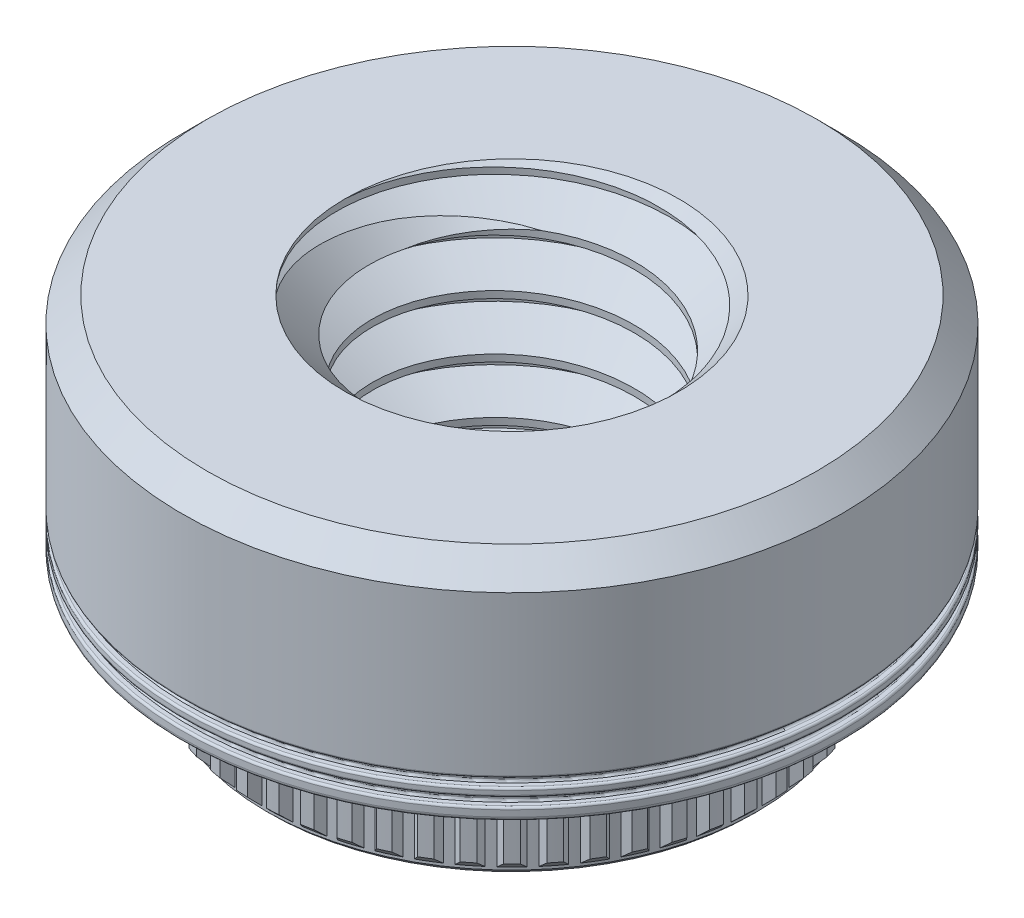
from build123d import *

# Parameters (mm, degrees)
SWEEP1_PITCH       = 0.79375
CUT_EXTRUDE1_REACH = 10.242
CIRPATTERN1_COUNT  = 52


with BuildPart() as part:
    # Sketch3 → Revolve1 (revolve)
    with BuildSketch(Plane.XY, mode=Mode.PRIVATE) as revolve1_sk:
        with BuildLine():
            Line((-2.413, 2.3749), (-2.413, -2.3749))
            Line((-2.413, -2.3749), (-3.48535625, -2.3749))
            Line((-3.48535625, -2.3749), (-3.54965, -2.31060625))
            Line((-3.54965, -2.31060625), (-3.54965, -2.27203))
            Line((-3.54965, -2.27203), (-3.683, -2.13868))
            Line((-3.683, -2.13868), (-3.683, -1.27))
            Line((-3.683, -1.27), (-3.54965, -1.13665))
            Line((-3.54965, -1.13665), (-3.5258375, -1.13665))
            ThreePointArc((-3.5258375, -1.13665), (-3.475323559, -1.115726441), (-3.4544, -1.0652125))
            Line((-3.4544, -1.0652125), (-3.4544, -0.9223375))
            ThreePointArc((-3.4544, -0.9223375), (-3.475323559, -0.871823559), (-3.5258375, -0.8509))
            Line((-3.5258375, -0.8509), (-4.70201625, -0.8509))
            ThreePointArc((-4.70201625, -0.8509), (-4.74478472, -0.83318472), (-4.7625, -0.79041625))
            Line((-4.7625, -0.79041625), (-4.7625, -0.699690625))
            ThreePointArc((-4.7625, -0.699690625), (-4.75364236, -0.67830639), (-4.732258125, -0.66944875))
            Line((-4.732258125, -0.66944875), (-4.671774375, -0.66944875))
            ThreePointArc((-4.671774375, -0.66944875), (-4.65039014, -0.66059111), (-4.6415325, -0.639206875))
            Line((-4.6415325, -0.639206875), (-4.6415325, -0.578723125))
            ThreePointArc((-4.6415325, -0.578723125), (-4.65039014, -0.55733889), (-4.671774375, -0.54848125))
            Line((-4.671774375, -0.54848125), (-4.732258125, -0.54848125))
            ThreePointArc((-4.732258125, -0.54848125), (-4.75364236, -0.53962361), (-4.7625, -0.518239375))
            Line((-4.7625, -0.518239375), (-4.7625, -0.457755625))
            ThreePointArc((-4.7625, -0.457755625), (-4.75364236, -0.43637139), (-4.732258125, -0.42751375))
            Line((-4.732258125, -0.42751375), (-4.671774375, -0.42751375))
            ThreePointArc((-4.671774375, -0.42751375), (-4.65039014, -0.41865611), (-4.6415325, -0.397271875))
            Line((-4.6415325, -0.397271875), (-4.6415325, -0.336788125))
            ThreePointArc((-4.6415325, -0.336788125), (-4.65039014, -0.31540389), (-4.671774375, -0.30654625))
            Line((-4.671774375, -0.30654625), (-4.732258125, -0.30654625))
            ThreePointArc((-4.732258125, -0.30654625), (-4.75364236, -0.29768861), (-4.7625, -0.276304375))
            Line((-4.7625, -0.276304375), (-4.7625, 2.0177125))
            Line((-4.7625, 2.0177125), (-4.4053125, 2.3749))
            Line((-4.4053125, 2.3749), (-2.413, 2.3749))
        make_face()
    revolve(revolve1_sk.sketch.rotate(Axis((0, -2.3749, 0), (0, 1, 0)), 180), axis=Axis((0, -2.3749, 0), (0, 1, 0)))

    # Sweep1: the profile of Sketch5 screwed along a right-hand helix of 6.984 turns, 8 arcs to a turn; built about Z, then put on its axis
    sweep1_z = Axis((0, 0, 0), (0, 0, 1))
    sweep1_corners = [(2.455962979, 0, 0.024804687), (2.455962979, 0, -0.719335938), (1.897444252, 0, -0.396875), (1.897444252, 0, -0.29765625)]
    with BuildLine(mode=Mode.PRIVATE) as sweep1_profile:
        Line(sweep1_corners[0], sweep1_corners[1])
        Line(sweep1_corners[1], sweep1_corners[2])
        Line(sweep1_corners[2], sweep1_corners[3])
        Line(sweep1_corners[3], sweep1_corners[0])
    sweep1_cap = Face(sweep1_profile.wire())
    sweep1_turn_angles = [0, 22.5, 45, 67.5, 90, 112.5, 135, 157.5, 180, 202.5, 225, 247.5, 270, 292.5, 315, 337.5, 360]
    sweep1_turn_weights = [1, 0.9238795325112867, 1, 0.9238795325112867, 1, 0.9238795325112867, 1, 0.9238795325112867, 1, 0.9238795325112867, 1, 0.9238795325112867, 1, 0.9238795325112867, 1, 0.9238795325112867, 1]
    sweep1_turn_rails = [Edge.make_bspline([Vector(p[0], p[1], 0).rotate(sweep1_z, sweep1_turn_angles[k]) / sweep1_turn_weights[k] + Vector(0, 0, p[2] + SWEEP1_PITCH * sweep1_turn_angles[k] / 360) for k in range(17)], [0, 0, 0, 1, 1, 2, 2, 3, 3, 4, 4, 5, 5, 6, 6, 7, 7, 8, 8, 8], 2, sweep1_turn_weights) for p in sweep1_corners]
    sweep1_turn_sides = [Face.make_surface_from_curves(sweep1_turn_rails[p[0]], sweep1_turn_rails[p[1]]) for p in [(0, 1), (1, 2), (2, 3), (3, 0)]]
    sweep1_last_angles = [2160, 2182.5, 2205, 2227.5, 2250, 2272.5, 2295, 2317.5, 2340, 2362.5, 2385, 2407.5, 2430, 2452.5, 2475, 2494.62, 2514.24]
    sweep1_last_weights = [1, 0.9238795325112867, 1, 0.9238795325112867, 1, 0.9238795325112867, 1, 0.9238795325112867, 1, 0.9238795325112867, 1, 0.9238795325112867, 1, 0.9238795325112867, 1, 0.9419403007087647, 1]
    sweep1_last_rails = [Edge.make_bspline([Vector(p[0], p[1], 0).rotate(sweep1_z, sweep1_last_angles[k]) / sweep1_last_weights[k] + Vector(0, 0, p[2] + SWEEP1_PITCH * sweep1_last_angles[k] / 360) for k in range(17)], [0, 0, 0, 1, 1, 2, 2, 3, 3, 4, 4, 5, 5, 6, 6, 7, 7, 8, 8, 8], 2, sweep1_last_weights) for p in sweep1_corners]
    sweep1_last_sides = [Face.make_surface_from_curves(sweep1_last_rails[p[0]], sweep1_last_rails[p[1]]) for p in [(0, 1), (1, 2), (2, 3), (3, 0)]]
    sweep1 = Plane(origin=(0, 2.3749, 0), x_dir=(-1, 0, 0), z_dir=(0, -1, 0)) * Solid(Shell([*[p.moved(Location((0, 0, SWEEP1_PITCH * i))) for i in range(6) for p in sweep1_turn_sides], *sweep1_last_sides, sweep1_cap, sweep1_cap.rotate(sweep1_z, 2514.24).moved(Location((0, 0, SWEEP1_PITCH * 2514.24 / 360)))]))
    add(sweep1)

    # Sketch6 → Cut-Revolve1 (revolve, cut)
    with BuildSketch(Plane.XY):
        Polygon((-2.498925958, 3.436540625), (-2.498925958, 2.3749), (-2.413, 2.3749), (-1.811518294, 1.773418294), (-1.811518294, 3.436540625), align=None)
        Polygon((-2.498925958, -2.3749), (-2.413, -2.3749), (-1.811518294, -1.773418294), (-1.811518294, -3.436540625), (-2.498925958, -3.436540625), align=None)
    revolve(axis=Axis((0, -2.3749, 0), (0, 1, 0)), mode=Mode.SUBTRACT)

    # Cut-Extrude1: up to this cone (the profile starts inside it)
    cut_extrude1_end = Plane(origin=(0, -2.3749, 0), z_dir=(0, -1, 0)).offset(-4.787899) * Cone(1e-06, 20.3178, 20.317799, align=(Align.CENTER, Align.CENTER, Align.MIN), mode=Mode.PRIVATE)
    # Sketch7 → Cut-Extrude1 (cut, up to the surface)
    with BuildSketch(Plane.XZ.offset(2.3749), mode=Mode.PRIVATE) as cut_extrude1_sk1:
        Polygon((-0.138507329, 3.683), (-0.061517671, 3.54965), (0, 3.54965), (0.061517671, 3.54965), (0.138507329, 3.683), align=None)
    cut_extrude1_tool1 = extrude(cut_extrude1_sk1.sketch, amount=-CUT_EXTRUDE1_REACH, mode=Mode.PRIVATE) & cut_extrude1_end
    cut_extrude1 = cut_extrude1_tool1.solids().sort_by_distance((0, -2.3749, 3.624879))[0]
    add(cut_extrude1, mode=Mode.SUBTRACT)

    # CirPattern1: Cut-Extrude1 ×52 about axis
    cirpattern1_axis = Axis((0, 0, 0), (0, 1, 0))
    for i in range(1, CIRPATTERN1_COUNT):
        add(cut_extrude1.rotate(cirpattern1_axis, i * 360 / CIRPATTERN1_COUNT), mode=Mode.SUBTRACT)


solid = part.part
